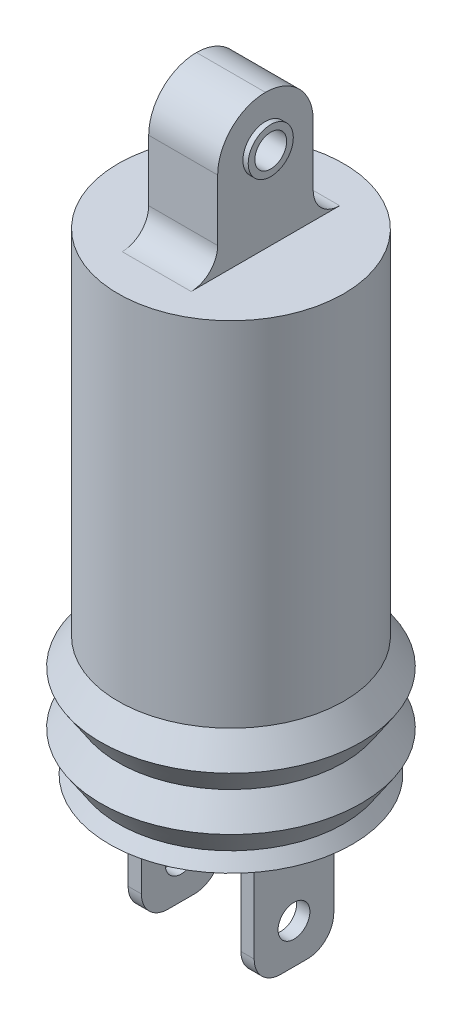
from build123d import *

# Parameters (mm, degrees)
SZKIC2_W                    = 26
SZKIC2_H                    = 36
DODANIE_WYCI_GNI_CIE1_DEPTH = 51
SZKIC3_W                    = 47.5
SZKIC3_H                    = 30
DODANIE_WYCI_GNI_CIE2_DEPTH = 5
SZKIC4_W                    = 5
SZKIC4_H                    = 30
DODANIE_WYCI_GNI_CIE3_DEPTH = 46
SZKIC5_R                    = 6
WYTNIJ_WYCI_GNI_CIE1_DEPTH  = 197.7283515
SZKIC6_R                    = 6
WYTNIJ_WYCI_GNI_CIE2_DEPTH  = 46
DODANIE_WYCI_GNI_CIE4_START = 2
SZKIC8_R                    = 8.5
SZKIC8_R_2                  = 6
DODANIE_WYCI_GNI_CIE4_DEPTH = 2
ZAOKR_GLENIE1_R             = 18
ZAOKR_GLENIE2_R             = 10
ZAOKR_GLENIE3_R             = 10


with BuildPart() as part:
    # Szkic1 → Obrót1 (revolve)
    with BuildSketch(Plane.XY, mode=Mode.PRIVATE) as obr_t1_sk:
        Polygon((-42.5, 0), (-42.5, 53), (0, 53), (0, -125), (-45.81662479, -125), (-42.5, -120), (-49.133249581, -110), (-42.5, -100), (-49.133249581, -90), (-42.5, -80), align=None)
    revolve(obr_t1_sk.sketch.rotate(Axis((0, -125, 0), (0, 1, 0)), 180), axis=Axis((0, -125, 0), (0, 1, 0)))

    # Szkic2 → Dodanie-wyciągnięcie1 (add)
    with BuildSketch(Plane(origin=(0, 53, 0), x_dir=(1, 0, 0), z_dir=(0, 1, 0))):
        Rectangle(SZKIC2_W, SZKIC2_H)
    extrude(amount=DODANIE_WYCI_GNI_CIE1_DEPTH)

    # Szkic3 → Dodanie-wyciągnięcie2 (add)
    with BuildSketch(Plane.XZ.offset(125)):
        Rectangle(SZKIC3_W, SZKIC3_H)
    extrude(amount=DODANIE_WYCI_GNI_CIE2_DEPTH)

    # Szkic4 → Dodanie-wyciągnięcie3 (add)
    with BuildSketch(Plane.XZ.offset(130)):
        with Locations((-21.25, 0)):
            Rectangle(SZKIC4_W, SZKIC4_H)
        with Locations((21.25, 0)):
            Rectangle(SZKIC4_W, SZKIC4_H)
    extrude(amount=DODANIE_WYCI_GNI_CIE3_DEPTH)

    # Szkic5 → Wytnij-wyciągnięcie1 (cut, through all)
    with BuildSketch(Plane(origin=(23.75, 0, 0), x_dir=(0, 0, -1), z_dir=(1, 0, 0))):
        with Locations((0, -161)):
            Circle(SZKIC5_R)
    extrude(amount=-WYTNIJ_WYCI_GNI_CIE1_DEPTH, mode=Mode.SUBTRACT)

    # Szkic6 → Wytnij-wyciągnięcie2 (cut)
    with BuildSketch(Plane(origin=(13, 0, 0), x_dir=(0, 0, -1), z_dir=(1, 0, 0))):
        with Locations((0, 86)):
            Circle(SZKIC6_R)
    extrude(amount=-WYTNIJ_WYCI_GNI_CIE2_DEPTH, mode=Mode.SUBTRACT)

    # Szkic8 → Dodanie-wyciągnięcie4 (add)
    with BuildSketch(Plane(origin=(13, 0, 0), x_dir=(0, 0, -1), z_dir=(1, 0, 0)).offset(DODANIE_WYCI_GNI_CIE4_START)):
        with Locations(Location((0, 86, 0), (0, 0, 180))):
            Circle(SZKIC8_R)
        with Locations((0, 86)):
            Circle(SZKIC8_R_2, mode=Mode.SUBTRACT)
    dodanie_wyci_gni_cie4 = extrude(amount=-DODANIE_WYCI_GNI_CIE4_DEPTH)

    # Lustro1: Dodanie-wyciągnięcie4 across plane
    add(dodanie_wyci_gni_cie4.mirror(Plane(origin=(0, 0, 0), x_dir=(0, 0, 1), z_dir=(1, 0, 0))))

    # Zaokrąglenie1
    zaokr_glenie1_edges = [part.edges().sort_by_distance(p)[0] for p in [
        (0, 104, 18),
        (0, 104, -18),
    ]]
    fillet(zaokr_glenie1_edges, radius=ZAOKR_GLENIE1_R - 0.0001)  # a hair under: the kernel refuses the full size

    # Zaokrąglenie2
    zaokr_glenie2_edges = [part.edges().sort_by_distance(p)[0] for p in [
        (0, 53, -18),
        (0, 53, 18),
    ]]
    fillet(zaokr_glenie2_edges, radius=ZAOKR_GLENIE2_R)

    # Zaokrąglenie3
    zaokr_glenie3_edges = [part.edges().sort_by_distance(p)[0] for p in [
        (-21.25, -176, -15),
        (-21.25, -176, 15),
        (21.25, -176, 15),
        (21.25, -176, -15),
    ]]
    fillet(zaokr_glenie3_edges, radius=ZAOKR_GLENIE3_R)


solid = part.part
